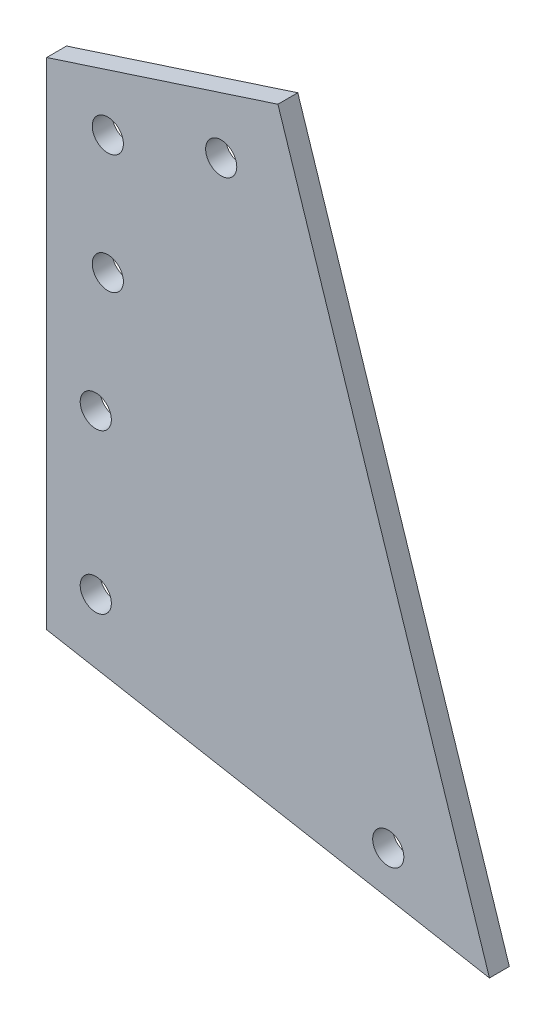
from build123d import *

# Parameters (mm, degrees)
BOSS_EXTRUDE1_DEPTH    = 3.175
F_10_CLEARANCE_HOLE1_D = 4.9784


with BuildPart() as part:
    # Sketch2 → Boss-Extrude1 (new body)
    with BuildSketch(Plane.XY):
        Polygon((75.605515224, 191.084223429), (41.804664545, 295.09857273), (4.854209552, 283.091029346), (4.854209552, 203.901454104), align=None)
    extrude(amount=BOSS_EXTRUDE1_DEPTH)

    # #10 Clearance Hole1 (through all)
    with Locations(Plane.XY.offset(3.175)):
        with Locations((32.740251946, 283.138719963), (59.435154755, 200.980257064), (12.7, 238.125), (12.7, 212.725), (14.622625311, 277.25194622), (14.622625311, 258.20194622)):
            Hole(F_10_CLEARANCE_HOLE1_D / 2)


solid = part.part
